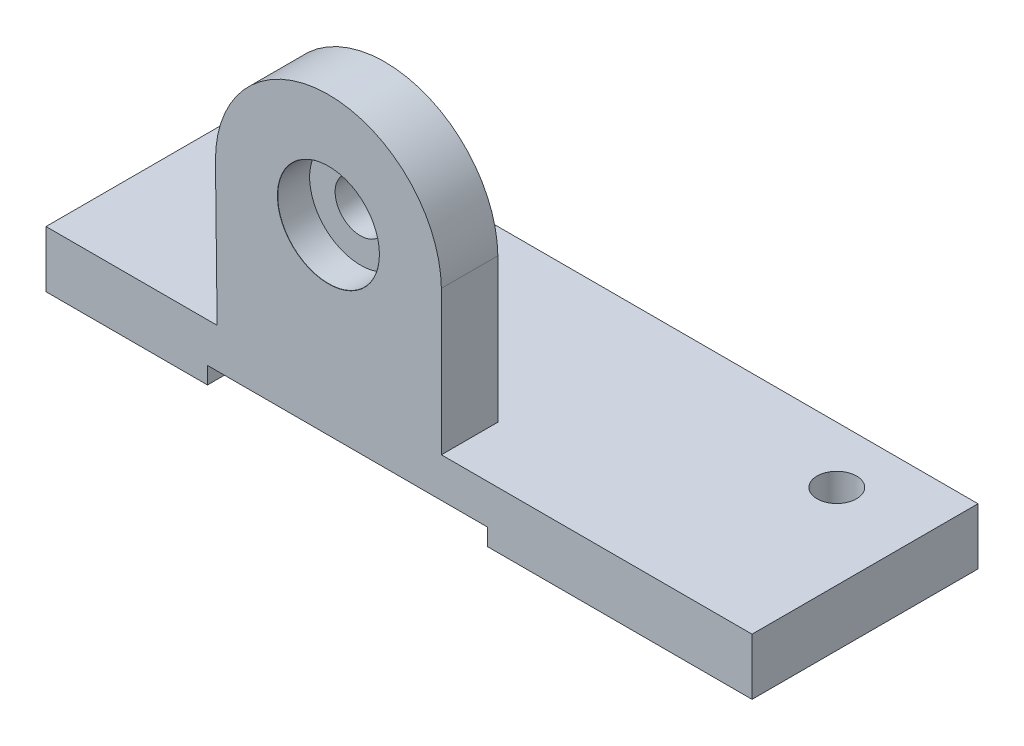
from build123d import *

# Parameters (mm, degrees)
SKETCH1_W                = 125
SKETCH1_H                = 40
BASEPLATE_DEPTH          = 10
VERTPLATE_DEPTH          = 10
SKETCH4_W                = 49.544606874
SKETCH4_H                = 3
CUT_EXTRUDE1_DEPTH       = 143.393710415
F_7_0_7_DIAMETER_HOLE1_D = 7


with BuildPart() as part:
    # Sketch1 → BasePlate (new body)
    with BuildSketch(Plane(origin=(0, 0, 0), x_dir=(1, 0, 0), z_dir=(0, 1, 0))):
        with Locations((62.5, 20)):
            Rectangle(SKETCH1_W, SKETCH1_H)
    extrude(amount=BASEPLATE_DEPTH)

    # Sketch2 → VertPlate (add)
    with BuildSketch(Plane.XY):
        with BuildLine():
            Line((69.997962264, 35.521066513), (69.997962264, 0))
            Line((69.997962264, 0), (30.413672611, 0))
            Line((30.413672611, 0), (30.00138744, 35))
            ThreePointArc((30.00138744, 35), (49.739466541, 55.233878169), (69.997962264, 35.521066513))
        make_face()
    extrude(amount=-VERTPLATE_DEPTH)

    # Sketch4 → Cut-Extrude1 (cut, through all)
    with BuildSketch(Plane.XY):
        with Locations((53.36544805, 1.5)):
            Rectangle(SKETCH4_W, SKETCH4_H)
    extrude(amount=-CUT_EXTRUDE1_DEPTH, mode=Mode.SUBTRACT)

    # Sketch6 → CBORE for M8 Hex Head Bolt1 (revolve, cut)
    with BuildSketch(Plane(origin=(50, 35.235575183, 0), x_dir=(0, -1, 0), z_dir=(1, 0, 0))):
        Polygon((0, 0), (0, 40), (4.5, 40), (4.5, 5.68), (9.005, 5.68), (9.005, 0.025), (9.03, 0), align=None)
    revolve(axis=Axis((50, 35.235575183, 6.35), (0, 0, -1)), mode=Mode.SUBTRACT)

    # Ø7.0 (7) Diameter Hole1 (through all)
    with Locations(Plane(origin=(0, 10, 0), x_dir=(1, 0, 0), z_dir=(0, 1, 0))):
        with Locations((15, 30), (110, 30)):
            Hole(F_7_0_7_DIAMETER_HOLE1_D / 2)


solid = part.part
